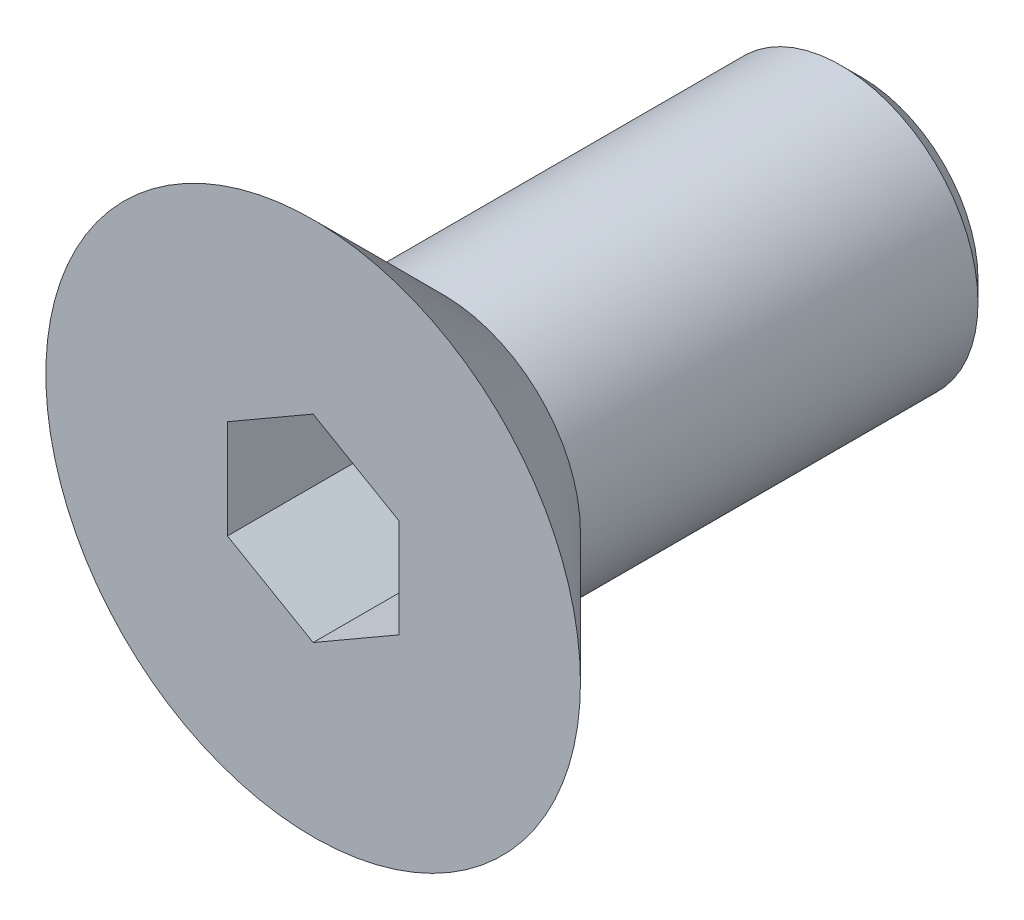
from build123d import *

# Parameters (mm, degrees)
SKETCH1_R           = 4
BOSS_EXTRUDE1_DEPTH = 2.3
SKETCH2_R           = 2
BOSS_EXTRUDE2_DEPTH = 5.7
CHAMFER1_SIZE       = 0.3
CUT_EXTRUDE1_DEPTH  = 2
CHAMFER2_SIZE       = 2.4


with BuildPart() as part:
    # Sketch1 → Boss-Extrude1 (new body)
    with BuildSketch(Plane.XY):
        Circle(SKETCH1_R)
    extrude(amount=BOSS_EXTRUDE1_DEPTH)

    # Sketch2 → Boss-Extrude2 (add)
    with BuildSketch(Plane(origin=(0, 0, 0), x_dir=(-1, 0, 0), z_dir=(0, 0, -1))):
        with Locations(Location((0, 0, 0), (0, 0, 180))):
            Circle(SKETCH2_R)
    extrude(amount=BOSS_EXTRUDE2_DEPTH)

    # Chamfer1
    chamfer1_edges = [part.edges().sort_by_distance(p)[0] for p in [
        (-2, 0, -5.7),
    ]]
    chamfer(chamfer1_edges, length=CHAMFER1_SIZE)

    # Sketch3 → Cut-Extrude1 (cut)
    with BuildSketch(Plane.XY.offset(2.3)):
        Polygon((0, 1.443375673), (-1.25, 0.721687836), (-1.25, -0.721687836), (0, -1.443375673), (1.25, -0.721687836), (1.25, 0.721687836), align=None)
    extrude(amount=-CUT_EXTRUDE1_DEPTH, mode=Mode.SUBTRACT)

    # Chamfer2
    # the kernel refuses this chamfer: 2.4 mm, written as the material it takes off along each edge
    with BuildSketch(Plane(origin=(0, 0, 0), x_dir=(1, 0, 0), z_dir=(0, -1, 0))) as chamfer2_piece_1_section:
        Polygon((4 - CHAMFER2_SIZE, 0), (4, CHAMFER2_SIZE), (4, 0), align=None)
    chamfer2_piece_1 = revolve(axis=Axis((0, 0, 0), (0, 0, 1)), mode=Mode.PRIVATE)
    chamfer2_piece_1 = chamfer2_piece_1 - Plane(origin=(0, 0, 1.405884102), x_dir=(1, 0, 0), z_dir=(0, 0, 1)) * Cylinder(2, 16, mode=Mode.PRIVATE)
    add(chamfer2_piece_1, mode=Mode.SUBTRACT)


solid = part.part
